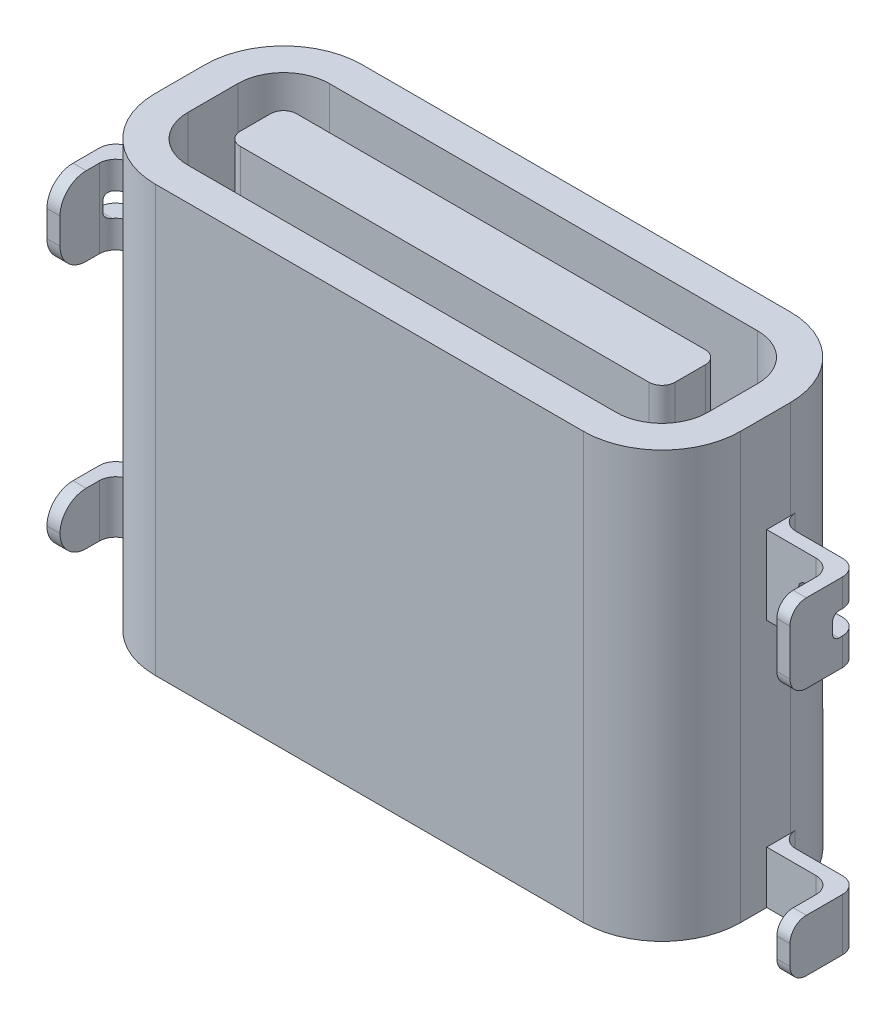
from build123d import *

# Parameters (mm, degrees)
SKETCH1_W                       = 8.94
SKETCH1_H                       = 3.16
BOSS_EXTRUDE1_DEPTH             = 6.5
FILLET1_R                       = 1.2
SHELL1_T                        = -0.5
SKETCH2_W                       = 6.640969262
SKETCH2_H                       = 0.860969262
BOSS_EXTRUDE2_DEPTH             = 6
FILLET2_R                       = 0.2
SKETCH3_W                       = 1.105
SKETCH3_H                       = 1.2
SKETCH3_H_2                     = 0.8
BOSS_EXTRUDE3_DEPTH             = 0.2
SKETCH4_W                       = 0.2
SKETCH4_H                       = 1.2
SKETCH4_H_2                     = 0.8
BOSS_EXTRUDE4_DEPTH             = 0.85
BOSS_EXTRUDE4_DIRECTION_2_REACH = 10.712
FILLET3_R                       = 0.25
SKETCH5_W                       = 0.935241106
SKETCH5_H                       = 0.36038381
CUT_EXTRUDE1_DEPTH              = 0.4
FILLET4_R                       = 0.1
FILLET5_R                       = 0.4
FILLET6_R                       = 0.4
SKETCH6_W                       = 0.25
SKETCH6_H                       = 0.7
BOSS_EXTRUDE5_DEPTH             = 0.15
FILLET7_R                       = 0.25
FILLET8_R                       = 0.1


# Some blends are built 0.0001 mm under size
with BuildPart() as part:
    # Sketch1 → Boss-Extrude1 (new body)
    with BuildSketch(Plane(origin=(0, 0, 0), x_dir=(1, 0, 0), z_dir=(0, 1, 0))):
        Rectangle(SKETCH1_W, SKETCH1_H)
    extrude(amount=BOSS_EXTRUDE1_DEPTH)

    # Fillet1
    fillet1_edges = [part.edges().sort_by_distance(p)[0] for p in [
        (4.47, 3.25, 1.58),
        (-4.47, 3.25, 1.58),
        (-4.47, 3.25, -1.58),
        (4.47, 3.25, -1.58),
    ]]
    fillet(fillet1_edges, radius=FILLET1_R)

    # Shell1
    shell1_openings = [part.faces().sort_by_distance(p)[0] for p in [
        (0, 6.5, 0),
    ]]
    offset(amount=SHELL1_T, openings=shell1_openings, kind=Kind.INTERSECTION)

    # Sketch2 → Boss-Extrude2 (add)
    with BuildSketch(Plane(origin=(0, 0.5, 0), x_dir=(1, 0, 0), z_dir=(0, 1, 0))):
        Rectangle(SKETCH2_W, SKETCH2_H)
    extrude(amount=BOSS_EXTRUDE2_DEPTH)

    # Fillet2
    fillet2_edges = [part.edges().sort_by_distance(p)[0] for p in [
        (3.320484631, 3.5, 0.430484631),
        (3.320484631, 3.5, -0.430484631),
        (-3.320484631, 3.5, -0.430484631),
        (-3.320484631, 3.5, 0.430484631),
    ]]
    fillet(fillet2_edges, radius=FILLET2_R)

    # Sketch3 → Boss-Extrude3 (add)
    with BuildSketch(Plane.XY.offset(-0.02)):
        with Locations((-5.0225, 4.4)):
            Rectangle(SKETCH3_W, SKETCH3_H)
        with Locations((-5.0225, 0.4)):
            Rectangle(SKETCH3_W, SKETCH3_H_2)
    boss_extrude3 = extrude(amount=-BOSS_EXTRUDE3_DEPTH)

    # Sketch4 → Boss-Extrude4 (add)
    with BuildSketch(Plane.XY.offset(-0.02)):
        with Locations((-5.575, 4.4)):
            Rectangle(SKETCH4_W, SKETCH4_H)
        with Locations((-5.575, 0.4)):
            Rectangle(SKETCH4_W, SKETCH4_H_2)
    boss_extrude4 = extrude(amount=BOSS_EXTRUDE4_DEPTH)

    # Boss-Extrude4 direction 2: up to this face of the body (flat: up to its plane)
    boss_extrude4_direction_2_end = Plane(part.part.faces().sort_by_distance((-5.0225, 4.4, -0.22))[0])
    # Sketch4 → Boss-Extrude4 direction 2 (add, up to the picked face)
    with BuildSketch(Plane.XY.offset(-0.02), mode=Mode.PRIVATE) as boss_extrude4_direction_2_sk1:
        with Locations((-5.575, 4.4)):
            Rectangle(SKETCH4_W, SKETCH4_H)
    boss_extrude4_direction_2_tool1 = split(extrude(boss_extrude4_direction_2_sk1.sketch, amount=-BOSS_EXTRUDE4_DIRECTION_2_REACH, mode=Mode.PRIVATE), bisect_by=boss_extrude4_direction_2_end, keep=Keep.BOTH, mode=Mode.PRIVATE)
    # Sketch4 → Boss-Extrude4 direction 2 (add, up to the picked face)
    with BuildSketch(Plane.XY.offset(-0.02), mode=Mode.PRIVATE) as boss_extrude4_direction_2_sk2:
        with Locations((-5.575, 0.4)):
            Rectangle(SKETCH4_W, SKETCH4_H_2)
    boss_extrude4_direction_2_tool2 = split(extrude(boss_extrude4_direction_2_sk2.sketch, amount=-BOSS_EXTRUDE4_DIRECTION_2_REACH, mode=Mode.PRIVATE), bisect_by=boss_extrude4_direction_2_end, keep=Keep.BOTH, mode=Mode.PRIVATE)
    boss_extrude4_direction_2_1 = boss_extrude4_direction_2_tool1.solids().sort_by(Axis((-5.575, 4.4, -0.02), (0, 0, -1)))[0]
    add(boss_extrude4_direction_2_1)
    boss_extrude4_direction_2_2 = boss_extrude4_direction_2_tool2.solids().sort_by(Axis((-5.575, 0.4, -0.02), (0, 0, -1)))[0]
    add(boss_extrude4_direction_2_2)
    boss_extrude4_direction_2 = boss_extrude4_direction_2_1 + boss_extrude4_direction_2_2  # Boss-Extrude4 direction 2 as one shape, for the pattern or mirror that repeats it

    # Fillet3
    fillet3_edges = [part.edges().sort_by_distance(p)[0] for p in [
        (-5.475, 4.4, -0.02),
        (-5.675, 4.4, -0.22),
        (-5.475, 0.4, -0.02),
        (-5.675, 0.4, -0.22),
    ]]
    fillet(fillet3_edges, radius=FILLET3_R)

    # Sketch5 → Cut-Extrude1 (cut)
    with BuildSketch(Plane(origin=(0, 0, -0.22), x_dir=(-1, 0, 0), z_dir=(0, 0, -1))):
        with Locations((5.425, 4.4)):
            Rectangle(SKETCH5_W, SKETCH5_H)
    cut_extrude1 = extrude(amount=-CUT_EXTRUDE1_DEPTH, mode=Mode.SUBTRACT)

    # Fillet4
    fillet4_edges = [part.edges().sort_by_distance(p)[0] for p in [
        (-5.572474487, 4.219808095, 0.18),
        (-4.957379447, 4.219808095, -0.12),
        (-5.572474487, 4.580191905, 0.18),
        (-4.957379447, 4.580191905, -0.12),
    ]]
    fillet(fillet4_edges, radius=FILLET4_R)

    # Fillet5
    # the kernel refuses this fillet: 0.4 mm, written as the material it adds along each edge
    with BuildSketch(Plane(origin=(-4.47, 5, -0.22), x_dir=(-1, 0, 0), z_dir=(0, -1, 0))) as fillet5_piece_1:
        with BuildLine():
            CenterArc((0.381897595, 0.4), FILLET5_R, 188.626926559, 81.373073441)
            Line((-0.013576804, 0.34), (-0.053124244, 0.334))
            ThreePointArc((-0.053124244, 0.334), (-0.04, 0.16), (-0.04, 0))
            Line((-0.04, 0), (0, -0.04))
            Line((0, -0.04), (0.381897595, -0.04))
            Line((0.381897595, -0.04), (0.381897595, 0))
        make_face()
    extrude(amount=1.2)
    with BuildSketch(Plane(origin=(-4.47, 0.8, -0.22), x_dir=(0.039899977959547465, 0, -0.9992036788156995), z_dir=(0, -1, 0))) as fillet5_piece_2:
        with BuildLine():
            CenterArc((0.384443766, -0.397553473), FILLET5_R, 96.340219202, 81.373073441)
            Line((-0.015237706, -0.381593482), (-0.055205853, -0.379997482))
            Line((-0.055205853, -0.379997482), (-0.039968147, 0.001595999))
            Line((-0.039968147, 0.001595999), (0.001595999, 0.039968147))
            ThreePointArc((0.001595999, 0.039968147), (0.161468588, 0.033584151), (0.335853685, 0.039755347))
            Line((0.335853685, 0.039755347), (0.340270965, 0))
        make_face()
    extrude(amount=0.8)

    # Fillet6
    fillet6_edges = [part.edges().sort_by_distance(p)[0] for p in [
        (-5.575, 5, 0.83),
        (-5.575, 3.8, 0.83),
        (-5.575, 0.8, 0.83),
        (-5.575, 0, 0.83),
    ]]
    fillet(fillet6_edges, radius=FILLET6_R - 0.0001)  # a hair under: the kernel refuses the full size

    # Sketch6 → Boss-Extrude5 (add)
    with BuildSketch(Plane.XY.offset(-0.02)):
        with Locations((-0.25, -0.35)):
            Rectangle(SKETCH6_W, SKETCH6_H)
        with Locations((-0.75, -0.35)):
            Rectangle(SKETCH6_W, SKETCH6_H)
        with Locations((-1.25, -0.35)):
            Rectangle(SKETCH6_W, SKETCH6_H)
        with Locations((-1.75, -0.35)):
            Rectangle(SKETCH6_W, SKETCH6_H)
        with Locations((-2.27, -0.35)):
            Rectangle(SKETCH6_W, SKETCH6_H)
        with Locations((-2.529105552, -0.35)):
            Rectangle(SKETCH6_W, SKETCH6_H)
        with Locations((-3.061650375, -0.35)):
            Rectangle(SKETCH6_W, SKETCH6_H)
        with Locations((-3.32, -0.35)):
            Rectangle(SKETCH6_W, SKETCH6_H)
    boss_extrude5 = extrude(amount=-BOSS_EXTRUDE5_DEPTH)

    # Mirror3: Boss-Extrude5 across plane
    add(boss_extrude5.mirror(Plane.ZY))

    # Mirror6: Boss-Extrude3, Boss-Extrude4, Boss-Extrude4 direction 2 across plane
    add(boss_extrude3.mirror(Plane.ZY))
    add(boss_extrude4.mirror(Plane.ZY))
    add(boss_extrude4_direction_2.mirror(Plane.ZY))

    # Mirror8: Cut-Extrude1 across plane
    add(cut_extrude1.mirror(Plane.ZY), mode=Mode.SUBTRACT)

    # Fillet7
    # the kernel refuses this fillet: 0.25 mm, written as the material it adds along each edge
    with BuildSketch(Plane(origin=(4.47, 5, -0.22), x_dir=(-0.009867044785247308, 0, -0.9999513195287089), z_dir=(0, -1, 0))) as fillet7_piece_1:
        with BuildLine():
            CenterArc((0.247548655, 0.249658928), FILLET7_R, 180.565349196, 86.441422801)
            Line((-0.002439175, 0.247192167), (-0.027437958, 0.246945491))
            Line((-0.027437958, 0.246945491), (-0.024998783, -0.000246676))
            Line((-0.024998783, -0.000246676), (0.000246676, -0.024998783))
            ThreePointArc((0.000246676, -0.024998783), (0.160238887, -0.023420056), (0.233188726, -0.024965893))
            Line((0.233188726, -0.024965893), (0.234494174, 0))
        make_face()
    extrude(amount=1.2)
    with BuildSketch(Plane(origin=(4.47, 0.8, -0.22), x_dir=(-0.009867044785247308, 0, -0.9999513195287089), z_dir=(0, -1, 0))) as fillet7_piece_2:
        with BuildLine():
            CenterArc((0.247548655, 0.249658928), FILLET7_R, 180.565349196, 86.441422801)
            Line((-0.002439175, 0.247192167), (-0.027437958, 0.246945491))
            Line((-0.027437958, 0.246945491), (-0.024998783, -0.000246676))
            Line((-0.024998783, -0.000246676), (0.000246676, -0.024998783))
            ThreePointArc((0.000246676, -0.024998783), (0.160238887, -0.023420056), (0.233188726, -0.024965893))
            Line((0.233188726, -0.024965893), (0.234494174, 0))
        make_face()
    extrude(amount=0.8)
    with BuildSketch(Plane(origin=(5.475, 3.8, -0.02), x_dir=(-1, 0, 0), z_dir=(0, 1, 0)), Plane(origin=(5.475, 4.580191905, -0.02), x_dir=(-1, 0, 0), z_dir=(0, 1, 0))) as fillet7_piece_3:
        with BuildLine():
            CenterArc((FILLET7_R, FILLET7_R), FILLET7_R, 180, 90)
            Line((0, FILLET7_R), (0, 0))
            Line((0, 0), (FILLET7_R, 0))
        make_face()
    extrude(amount=0.419808095)
    with BuildSketch(Plane(origin=(5.475, 3.175, -0.02), x_dir=(-1, 0, 0), z_dir=(0, 1, 0))) as fillet7_piece_4_section:
        with BuildLine():
            CenterArc((FILLET7_R, FILLET7_R), FILLET7_R, 180, 90)
            Line((0, FILLET7_R), (0, 0))
            Line((0, 0), (FILLET7_R, 0))
        make_face()
    fillet7_piece_4 = extrude(amount=1.669808095, mode=Mode.PRIVATE)
    fillet7_piece_4 = split(fillet7_piece_4, bisect_by=Plane(origin=(5.473487353, 4.219808095, 0.192474606), z_dir=(0, 1, 0)), keep=Keep.TOP, mode=Mode.PRIVATE)
    fillet7_piece_4 = split(fillet7_piece_4, bisect_by=Plane(origin=(5.473487353, 4.4, 0.18), z_dir=(0, 0, 1)), keep=Keep.TOP, mode=Mode.PRIVATE)
    add(fillet7_piece_4)
    with BuildSketch(Plane(origin=(5.475, 3.175, -0.02), x_dir=(-1, 0, 0), z_dir=(0, 1, 0))) as fillet7_piece_5_section:
        with BuildLine():
            CenterArc((FILLET7_R, FILLET7_R), FILLET7_R, 180, 90)
            Line((0, FILLET7_R), (0, 0))
            Line((0, 0), (FILLET7_R, 0))
        make_face()
    fillet7_piece_5 = extrude(amount=1.669808095, mode=Mode.PRIVATE)
    fillet7_piece_5 = split(fillet7_piece_5, bisect_by=Plane(origin=(5.418816273, 4.580191905, 0.034856735), z_dir=(0, 1, 0)), keep=Keep.TOP, mode=Mode.PRIVATE)
    add(fillet7_piece_5)
    with BuildSketch(Plane(origin=(5.475, 0, -0.02), x_dir=(-1, 0, 0), z_dir=(0, 1, 0))) as fillet7_piece_6:
        with BuildLine():
            CenterArc((FILLET7_R, FILLET7_R), FILLET7_R, 180, 90)
            Line((0, FILLET7_R), (0, 0))
            Line((0, 0), (FILLET7_R, 0))
        make_face()
    extrude(amount=0.8)
    with BuildSketch(Plane(origin=(5.475, 3.955191905, -0.02), x_dir=(-1, 0, 0), z_dir=(0, 1, 0))) as fillet7_piece_7_section:
        with BuildLine():
            CenterArc((FILLET7_R, FILLET7_R), FILLET7_R, 180, 90)
            Line((0, FILLET7_R), (0, 0))
            Line((0, 0), (FILLET7_R, 0))
        make_face()
    fillet7_piece_7 = extrude(amount=1.669808095, mode=Mode.PRIVATE)
    fillet7_piece_7 = split(fillet7_piece_7, bisect_by=Plane(origin=(5.418816273, 4.219808095, 0.034856735), z_dir=(0, -1, 0)), keep=Keep.TOP, mode=Mode.PRIVATE)
    add(fillet7_piece_7)
    with BuildSketch(Plane(origin=(5.475, 3.955191905, -0.02), x_dir=(-1, 0, 0), z_dir=(0, 1, 0))) as fillet7_piece_8_section:
        with BuildLine():
            CenterArc((FILLET7_R, FILLET7_R), FILLET7_R, 180, 90)
            Line((0, FILLET7_R), (0, 0))
            Line((0, 0), (FILLET7_R, 0))
        make_face()
    fillet7_piece_8 = extrude(amount=1.044808095, mode=Mode.PRIVATE)
    fillet7_piece_8 = split(fillet7_piece_8, bisect_by=Plane(origin=(5.473487353, 4.4, 0.18), z_dir=(0, 0, 1)), keep=Keep.TOP, mode=Mode.PRIVATE)
    add(fillet7_piece_8)
    # the kernel refuses this fillet: 0.25 mm, written as the material it takes off along each edge
    with BuildSketch(Plane(origin=(6.3, 3.8, 0.83), x_dir=(0, 1, 0), z_dir=(-1, 0, 0))) as fillet7_2_piece_1:
        with BuildLine():
            CenterArc((FILLET7_R, FILLET7_R), FILLET7_R, 180, 90)
            Line((0, FILLET7_R), (0, 0))
            Line((0, 0), (FILLET7_R, 0))
        make_face()
    extrude(amount=1.45, mode=Mode.SUBTRACT)
    with BuildSketch(Plane(origin=(4.85, 5, 0.83), x_dir=(0, 0, -1), z_dir=(1, 0, 0)), Plane(origin=(6.3, 0, 0.83), x_dir=(0, 0, -1), z_dir=(-1, 0, 0)), Plane(origin=(4.85, 0.8, 0.83), x_dir=(0, 0, -1), z_dir=(1, 0, 0))) as fillet7_2_piece_2:
        with BuildLine():
            CenterArc((FILLET7_R, -FILLET7_R), FILLET7_R, 90, 90)
            Line((0, -FILLET7_R), (0, 0))
            Line((0, 0), (FILLET7_R, 0))
        make_face()
    extrude(amount=1.45, mode=Mode.SUBTRACT)
    with BuildSketch(Plane(origin=(5.675, 4.844808095, -0.22), x_dir=(0, 0, 1), z_dir=(0, -1, 0)), Plane(origin=(5.675, 5.625, -0.22), x_dir=(0, 0, 1), z_dir=(0, -1, 0))) as fillet7_2_piece_3:
        with BuildLine():
            CenterArc((FILLET7_R, FILLET7_R), FILLET7_R, 180, 90)
            Line((0, FILLET7_R), (0, 0))
            Line((0, 0), (FILLET7_R, 0))
        make_face()
    extrude(amount=1.669808095, mode=Mode.SUBTRACT)
    with BuildSketch(Plane(origin=(5.675, 1.425, -0.22), x_dir=(-1, 0, 0), z_dir=(0, -1, 0))) as fillet7_2_piece_4:
        with BuildLine():
            CenterArc((FILLET7_R, -FILLET7_R), FILLET7_R, 90, 90)
            Line((0, -FILLET7_R), (0, 0))
            Line((0, 0), (FILLET7_R, 0))
        make_face()
    extrude(amount=2.05, mode=Mode.SUBTRACT)

    # Fillet8
    fillet8_edges = [part.edges().sort_by_distance(p)[0] for p in [
        (4.957379447, 4.219808095, -0.12),
        (5.575, 4.219808095, 0.18),
        (5.575, 4.580191905, 0.18),
        (4.957379447, 4.580191905, -0.12),
    ]]
    fillet(fillet8_edges, radius=FILLET8_R)


solid = part.part
